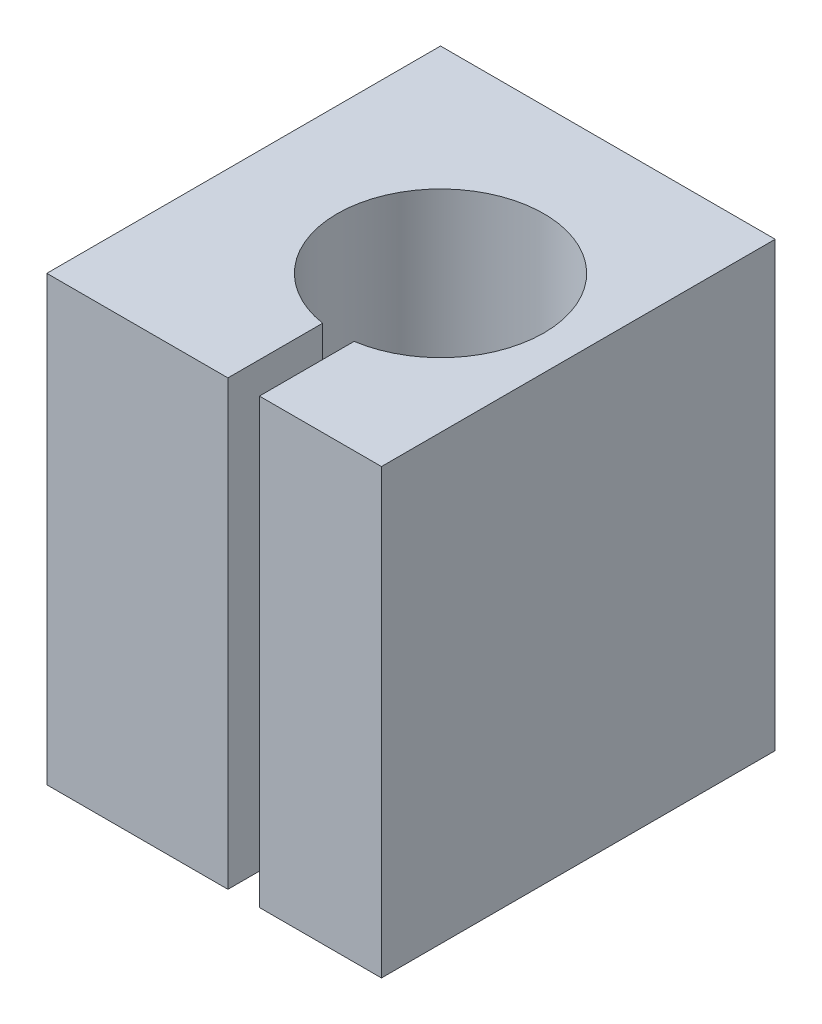
from build123d import *

# Parameters (mm, degrees)
EXTRUDE_1_DEPTH = 45


with BuildPart() as part:
    # Эскиз1 → Бобышка-Вытянуть1 (new body)
    with BuildSketch(Plane(origin=(0, 0, 0), x_dir=(1, 0, 0), z_dir=(0, 1, 0))):
        with BuildLine():
            Line((-17, 20), (17, 20))
            Line((17, 20), (17, -20))
            Line((17, -20), (4.6, -20))
            Line((4.6, -20), (4.6, -10.377379245))
            ThreePointArc((4.6, -10.377379245), (3, 10.5), (1.4, -10.377379245))
            Line((1.4, -10.377379245), (1.4, -20))
            Line((1.4, -20), (-17, -20))
            Line((-17, -20), (-17, 20))
        make_face()
    extrude(amount=EXTRUDE_1_DEPTH)


solid = part.part
